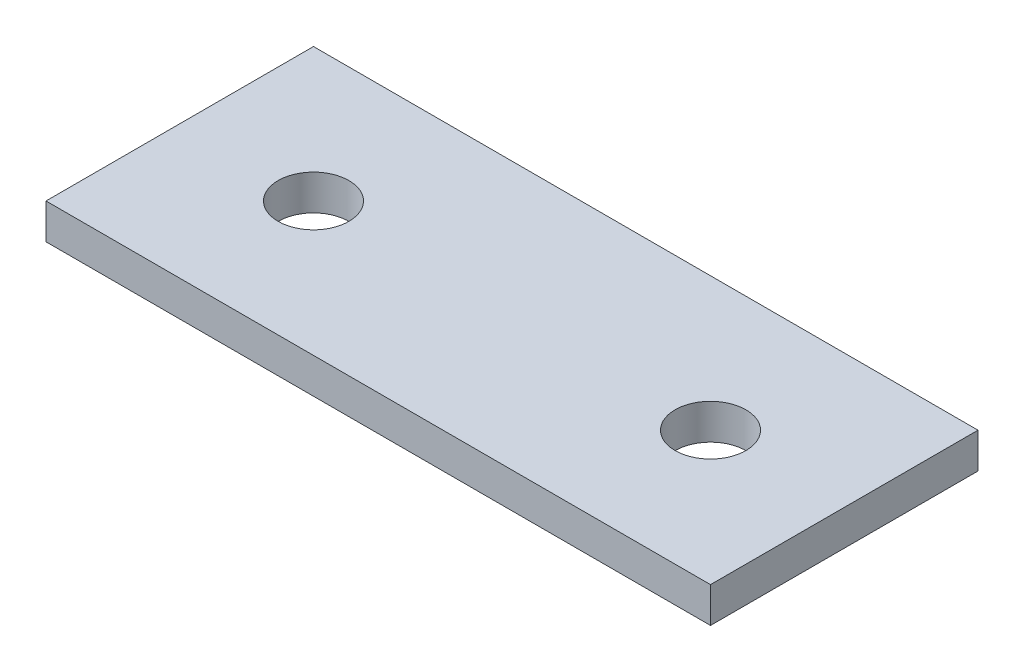
from build123d import *

# Parameters (mm, degrees)
SKETCH1_W           = 29.81
SKETCH1_H           = 12
SKETCH1_R           = 1.5875
BOSS_EXTRUDE1_DEPTH = 0.79375


with BuildPart() as part:
    # Sketch1 → Boss-Extrude1 (new, symmetric)
    with BuildSketch(Plane(origin=(0, 0, 0), x_dir=(1, 0, 0), z_dir=(0, 1, 0))):
        Rectangle(SKETCH1_W, SKETCH1_H)
        with Locations((-8.905, 0)):
            Circle(SKETCH1_R, mode=Mode.SUBTRACT)
        with Locations((8.905, 0)):
            Circle(SKETCH1_R, mode=Mode.SUBTRACT)
    extrude(amount=BOSS_EXTRUDE1_DEPTH, both=True)


solid = part.part
